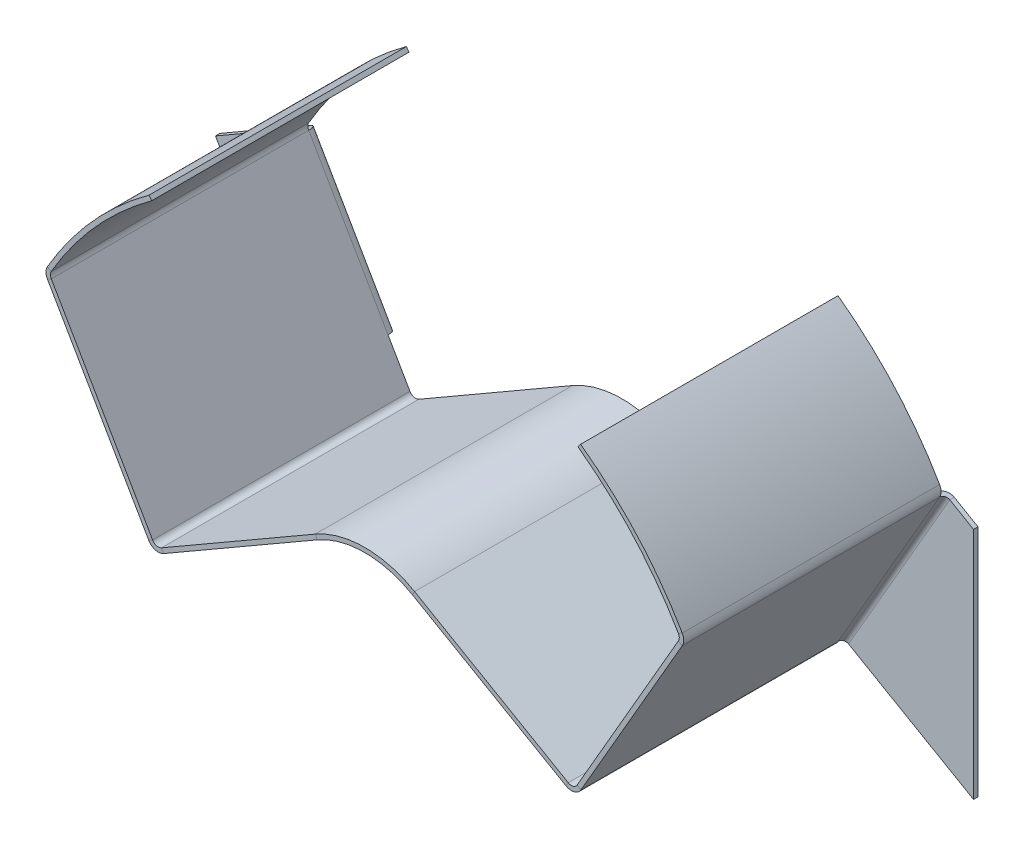
from build123d import *

# Parameters (mm, degrees)
BASE_FLANGE1_DEPTH      = 46.19
BASE_FLANGE1_DEPTH_BACK = 0.8128
EDGE_FLANGE1_DEPTH      = 29
EDGE_FLANGE1_BEND_DEPTH = 37
EDGE_FLANGE1_START      = 0.8128
EDGE_FLANGE1_FLAT_DEPTH = 0.8128


# Sheet-metal steps are written as plain solids
with BuildPart() as part:
    # Sketch1 → Base-Flange1 (new, two sides: drawn at the far end of the back side and taken through both)
    with BuildSketch(Plane.XY.offset(-BASE_FLANGE1_DEPTH_BACK)):
        with BuildLine():
            ThreePointArc((145.409019443, 88.185), (155.762419921, 78.86409034), (163.964489977, 67.603614987))
            ThreePointArc((163.964489977, 67.603614987), (164.234222289, 66.60231267), (163.96627389, 65.600531503))
            Line((163.96627389, 65.600531503), (145.46627389, 33.557591563))
            ThreePointArc((145.46627389, 33.557591563), (144.251861173, 32.625739911), (142.734223083, 32.825540756))
            Line((142.734223083, 32.825540756), (114.675, 49.025540756))
            ThreePointArc((114.675, 49.025540756), (106, 51.35), (97.325, 49.025540756))
            Line((97.325, 49.025540756), (69.265776917, 32.825540756))
            ThreePointArc((69.265776917, 32.825540756), (67.748138827, 32.625739911), (66.53372611, 33.557591563))
            Line((66.53372611, 33.557591563), (48.03372611, 65.600531503))
            ThreePointArc((48.03372611, 65.600531503), (47.76577771, 66.60231267), (48.035510023, 67.603614987))
            ThreePointArc((48.035510023, 67.603614987), (56.237580079, 78.86409034), (66.590980557, 88.185))
            Line((66.590980557, 88.185), (67.069060372, 87.52766939))
            ThreePointArc((67.069060372, 87.52766939), (56.841259359, 78.319833814), (48.738690489, 67.195961859))
            ThreePointArc((48.738690489, 67.195961859), (48.578577388, 66.601588804), (48.737631558, 66.006931503))
            Line((48.737631558, 66.006931503), (67.237631558, 33.963991563))
            ThreePointArc((67.237631558, 33.963991563), (67.958506947, 33.410844422), (68.859376917, 33.529446204))
            Line((68.859376917, 33.529446204), (96.9186, 49.729446204))
            ThreePointArc((96.9186, 49.729446204), (106, 52.1628), (115.0814, 49.729446204))
            Line((115.0814, 49.729446204), (143.140623083, 33.529446204))
            ThreePointArc((143.140623083, 33.529446204), (144.041493053, 33.410844422), (144.762368442, 33.963991563))
            Line((144.762368442, 33.963991563), (163.262368442, 66.006931503))
            ThreePointArc((163.262368442, 66.006931503), (163.421422612, 66.601588804), (163.261309511, 67.195961859))
            ThreePointArc((163.261309511, 67.195961859), (155.158740641, 78.319833814), (144.930939628, 87.52766939))
            Line((144.930939628, 87.52766939), (145.409019443, 88.185))
        make_face()
    extrude(amount=BASE_FLANGE1_DEPTH + BASE_FLANGE1_DEPTH_BACK)

    # Edge-Flange1 section (across the edge) → Edge-Flange1 (add)
    with BuildSketch(Plane(origin=(48.03372611, 65.600531503, -1.8128), x_dir=(0, 0, 1), z_dir=(0.5000000000000168, -0.866025403784429, 0))):
        with BuildLine():
            Line((-0.8128, 1), (-0.8128, 20))
            Line((-0.8128, 20), (0, 20))
            Line((0, 20), (0, 1))
            ThreePointArc((0, 1), (0.292893219, 0.292893219), (1, 0))
            Line((1, 0), (1, -0.8128))
            ThreePointArc((1, -0.8128), (-0.281843173, -0.281843173), (-0.8128, 1))
        make_face()
    extrude(amount=EDGE_FLANGE1_DEPTH)

    # Edge-Flange1 bend section (across the edge) → Edge-Flange1 bend (add)
    with BuildSketch(Plane(origin=(145.46627389, 33.557591563, -1.8128), x_dir=(0, 0, 1), z_dir=(0.4999999999999994, 0.866025403784439, 0))):
        with BuildLine():
            Line((-0.8128, 1), (0, 1))
            ThreePointArc((0, 1), (0.292893219, 0.292893219), (1, 0))
            Line((1, 0), (1, -0.8128))
            ThreePointArc((1, -0.8128), (-0.281843173, -0.281843173), (-0.8128, 1))
        make_face()
    extrude(amount=EDGE_FLANGE1_BEND_DEPTH)

    # Edge-Flange1 profile (on flange) → Edge-Flange1 flat (add)
    with BuildSketch(Plane(origin=(94.568842026, -54.599346401, -1.8128), x_dir=(0.4999999999999994, 0.866025403784439, 0), z_dir=(0, 0, -1)).offset(EDGE_FLANGE1_START)):
        Polygon((101.794863729, 1), (138.794863729, 1), (138.794863729, 6), (101.794863729, 27.36195996), align=None)
    extrude(amount=-EDGE_FLANGE1_FLAT_DEPTH)


solid = part.part
